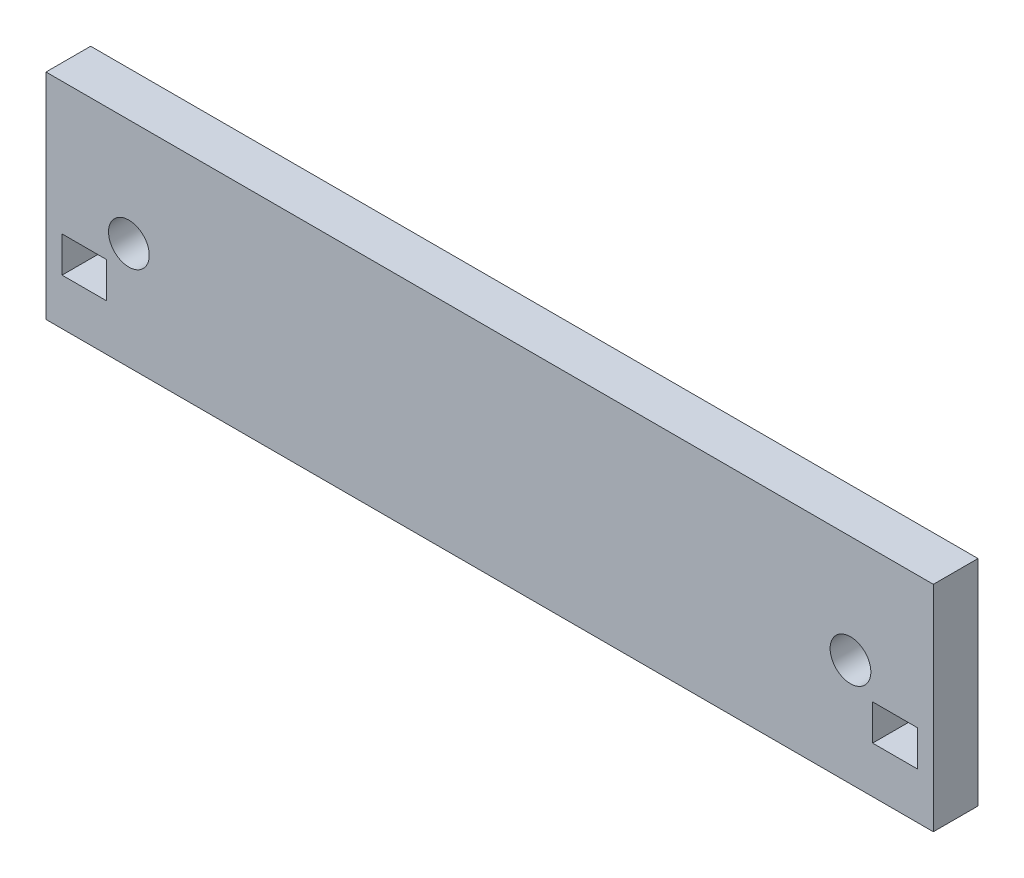
from build123d import *

# Parameters (mm, degrees)
SKETCH1_W           = 31.5468
SKETCH1_H           = 7.62
SKETCH1_R           = 0.7239
SKETCH1_W_2         = 1.5875
SKETCH1_H_2         = 1.27
BOSS_EXTRUDE1_DEPTH = 1.5875


with BuildPart() as part:
    # Sketch1 → Boss-Extrude1 (new body)
    with BuildSketch(Plane.XY):
        with Locations((-2.2606, 0)):
            Rectangle(SKETCH1_W, SKETCH1_H)
        with Locations((-15.0876, 0)):
            Circle(SKETCH1_R, mode=Mode.SUBTRACT)
        with Locations((10.5664, 0)):
            Circle(SKETCH1_R, mode=Mode.SUBTRACT)
        with Locations((-16.66875, -1.524)):
            Rectangle(SKETCH1_W_2, SKETCH1_H_2, mode=Mode.SUBTRACT)
        with Locations((12.14755, -1.524)):
            Rectangle(SKETCH1_W_2, SKETCH1_H_2, mode=Mode.SUBTRACT)
    extrude(amount=BOSS_EXTRUDE1_DEPTH)


solid = part.part
